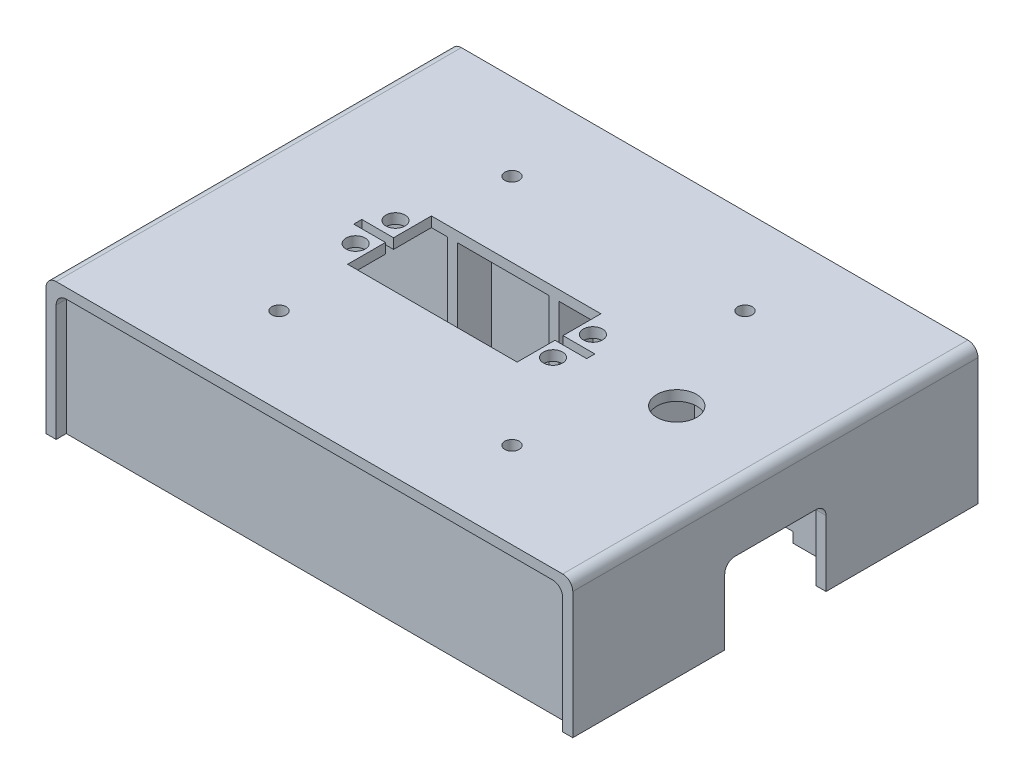
from build123d import *

# Parameters (mm, degrees)
EXTRUDE_THIN1_DEPTH     = 50.8
CUT_EXTRUDE1_REACH      = 92.098
SKETCH4_W               = 25.4
SKETCH4_H               = 19.05
FILLET1_R               = 2.54
EXTRUDE_THIN2_REACH     = 92.098
SKETCH3_W               = 63.5
SKETCH3_H               = 2.54
SKETCH9_W               = 2.54
SKETCH9_H               = 38.1
SKETCH9_H_2             = 91.44
SKETCH9_H_3             = 24.13
EXTRUDE_THIN3_DEPTH     = 31.75
CUT_EXTRUDE2_REACH      = 92.098
SKETCH5_W               = 42.5
SKETCH5_H               = 21
M4_CLEARANCE_HOLE1_D    = 4.8
CUT_EXTRUDE4_REACH      = 92.098
SKETCH7_W               = 7.96
SKETCH7_H               = 2.032
CUT_EXTRUDE5_REACH      = 113.138
SKETCH10_W              = 12.7
SKETCH10_H              = 9.525
M3_CLEARANCE_HOLE1_D    = 3.6
M8_CLEARANCE_HOLE1_D    = 10
SKETCH19_W              = 102.87
SKETCH19_H              = 72.39
SKETCH19_W_2            = 92.71
SKETCH19_H_2            = 62.23
CUT_EXTRUDE_THIN1_DEPTH = 2.54


# Read off the part's stored shape, not the designer's step: Mirror2
with BuildPart() as part:
    # Sketch2 → Extrude-Thin1 (new, symmetric)
    with BuildSketch(Plane.XY):
        Polygon((0, 31.75), (63.5, 31.75), (63.5, 0), (66.04, 0), (66.04, 34.29), (0, 34.29), align=None)
    extrude(amount=EXTRUDE_THIN1_DEPTH, both=True)

    # Sketch4 → Cut-Extrude1 (cut, up to next)
    with BuildSketch(Plane(origin=(66.04, 0, 0), x_dir=(0, 0, -1), z_dir=(1, 0, 0)), mode=Mode.PRIVATE) as cut_extrude1_sk1:
        with Locations((0, 9.525)):
            Rectangle(SKETCH4_W, SKETCH4_H)
    cut_extrude1_tool1 = extrude(cut_extrude1_sk1.sketch, amount=-CUT_EXTRUDE1_REACH, mode=Mode.PRIVATE) & part.part
    add(cut_extrude1_tool1.solids().sort_by_distance((66.04, 9.525, 0))[0], mode=Mode.SUBTRACT)

    # Fillet1
    fillet1_edges = [part.edges().sort_by_distance(p)[0] for p in [
        (64.77, 19.05, 12.7),
        (64.77, 19.05, -12.7),
        (63.5, 31.75, 0),
        (66.04, 34.29, 0),
    ]]
    fillet(fillet1_edges, radius=FILLET1_R)

    # Sketch3 → Extrude-Thin2 (add, up to next)
    with BuildSketch(Plane.XZ, mode=Mode.PRIVATE) as extrude_thin2_sk1:
        with Locations((31.75, 20.32)):
            Rectangle(SKETCH3_W, SKETCH3_H)
    extrude_thin2_tool1 = extrude(extrude_thin2_sk1.sketch, amount=-EXTRUDE_THIN2_REACH, mode=Mode.PRIVATE) - part.part
    # Sketch3 → Extrude-Thin2 (add, up to next)
    with BuildSketch(Plane.XZ, mode=Mode.PRIVATE) as extrude_thin2_sk2:
        with Locations((31.75, 46.99)):
            Rectangle(SKETCH3_W, SKETCH3_H)
    extrude_thin2_tool2 = extrude(extrude_thin2_sk2.sketch, amount=-EXTRUDE_THIN2_REACH, mode=Mode.PRIVATE) - part.part
    extrude_thin2_1 = extrude_thin2_tool1.solids().sort_by_distance((31.75, 0, 20.32))[0]
    add(extrude_thin2_1)
    extrude_thin2_2 = extrude_thin2_tool2.solids().sort_by_distance((31.75, 0, 46.99))[0]
    add(extrude_thin2_2)
    extrude_thin2 = extrude_thin2_1 + extrude_thin2_2  # Extrude-Thin2 as one shape, for the pattern or mirror that repeats it

    # Mirror1: Extrude-Thin2 across plane
    add(extrude_thin2.mirror(Plane.XY))

    # Mirror2: part across plane


with BuildPart() as part_1:
    add(part.part)
    add(part.part.mirror(Plane(origin=(0, 0, 0), x_dir=(0, 0, 1), z_dir=(1, 0, 0))))

    # Sketch9 → Extrude-Thin3 (add)
    with BuildSketch(Plane.XZ):
        with Locations((-25.4, 0)):
            Rectangle(SKETCH9_W, SKETCH9_H)
        Rectangle(SKETCH9_W, SKETCH9_H_2)
        with Locations((25.4, 0)):
            Rectangle(SKETCH9_W, SKETCH9_H)
        with Locations((-35.56, 33.655)):
            Rectangle(SKETCH9_W, SKETCH9_H_3)
        with Locations((-35.56, -33.655)):
            Rectangle(SKETCH9_W, SKETCH9_H_3)
        with Locations((35.56, 33.655)):
            Rectangle(SKETCH9_W, SKETCH9_H_3)
        with Locations((35.56, -33.655)):
            Rectangle(SKETCH9_W, SKETCH9_H_3)
    extrude(amount=-EXTRUDE_THIN3_DEPTH)

    # Sketch5 → Cut-Extrude2 (cut, up to next)
    with BuildSketch(Plane(origin=(0, 34.29, 0), x_dir=(1, 0, 0), z_dir=(0, 1, 0)), mode=Mode.PRIVATE) as cut_extrude2_sk1:
        with Locations((-9.464, 0)):
            Rectangle(SKETCH5_W, SKETCH5_H)
    cut_extrude2_tool1 = extrude(cut_extrude2_sk1.sketch, amount=-CUT_EXTRUDE2_REACH, mode=Mode.PRIVATE) & part_1.part
    add(cut_extrude2_tool1.solids().sort_by_distance((-9.464, 34.29, 0))[0], mode=Mode.SUBTRACT)

    # M4 Clearance Hole1 (through all)
    with Locations(Plane(origin=(0, 34.29, 0), x_dir=(1, 0, 0), z_dir=(0, 1, 0))):
        with Locations((15.286, -5), (15.286, 5), (-34.214, 5), (-34.214, -5)):
            Hole(M4_CLEARANCE_HOLE1_D / 2)

    # Sketch7 → Cut-Extrude4 (cut, up to next)
    with BuildSketch(Plane(origin=(0, 34.29, 0), x_dir=(1, 0, 0), z_dir=(0, 1, 0)), mode=Mode.PRIVATE) as cut_extrude4_sk1:
        with Locations((15.766, 0)):
            Rectangle(SKETCH7_W, SKETCH7_H)
    cut_extrude4_tool1 = extrude(cut_extrude4_sk1.sketch, amount=-CUT_EXTRUDE4_REACH, mode=Mode.PRIVATE) & part_1.part
    # Sketch7 → Cut-Extrude4 (cut, up to next)
    with BuildSketch(Plane(origin=(0, 34.29, 0), x_dir=(1, 0, 0), z_dir=(0, 1, 0)), mode=Mode.PRIVATE) as cut_extrude4_sk2:
        with Locations((-34.694, 0)):
            Rectangle(SKETCH7_W, SKETCH7_H)
    cut_extrude4_tool2 = extrude(cut_extrude4_sk2.sketch, amount=-CUT_EXTRUDE4_REACH, mode=Mode.PRIVATE) & part_1.part
    add(cut_extrude4_tool1.solids().sort_by_distance((15.766, 34.29, 0))[0], mode=Mode.SUBTRACT)
    add(cut_extrude4_tool2.solids().sort_by_distance((-34.694, 34.29, 0))[0], mode=Mode.SUBTRACT)

    # Sketch10 → Cut-Extrude5 (cut, up to next)
    with BuildSketch(Plane(origin=(26.67, 0, 0), x_dir=(0, 0, -1), z_dir=(1, 0, 0)), mode=Mode.PRIVATE) as cut_extrude5_sk1:
        with Locations((0, 4.7625)):
            Rectangle(SKETCH10_W, SKETCH10_H)
    cut_extrude5_tool1 = extrude(cut_extrude5_sk1.sketch, amount=-CUT_EXTRUDE5_REACH, mode=Mode.PRIVATE) & part_1.part
    add(cut_extrude5_tool1.solids().sort_by_distance((26.67, 4.7625, 0))[0], mode=Mode.SUBTRACT)

    # M3 Clearance Hole1 (through all)
    with Locations(Plane(origin=(0, 34.29, 0), x_dir=(1, 0, 0), z_dir=(0, 1, 0))):
        with Locations((-29.21, 29.21), (29.21, 29.21), (29.21, -29.21), (-29.21, -29.21)):
            Hole(M3_CLEARANCE_HOLE1_D / 2)

    # M8 Clearance Hole1 (through all)
    with Locations(Plane(origin=(0, 34.29, 0), x_dir=(1, 0, 0), z_dir=(0, 1, 0))):
        with Locations((41.309178157, 0)):
            Hole(M8_CLEARANCE_HOLE1_D / 2)

    # Sketch19 → Cut-Extrude-Thin1 (cut)
    with BuildSketch(Plane(origin=(0, 0, 0), x_dir=(-1, 0, 0), z_dir=(0, -1, 0))):
        Rectangle(SKETCH19_W, SKETCH19_H)
        Rectangle(SKETCH19_W_2, SKETCH19_H_2, mode=Mode.SUBTRACT)
    extrude(amount=-CUT_EXTRUDE_THIN1_DEPTH, mode=Mode.SUBTRACT)


solid = part_1.part
